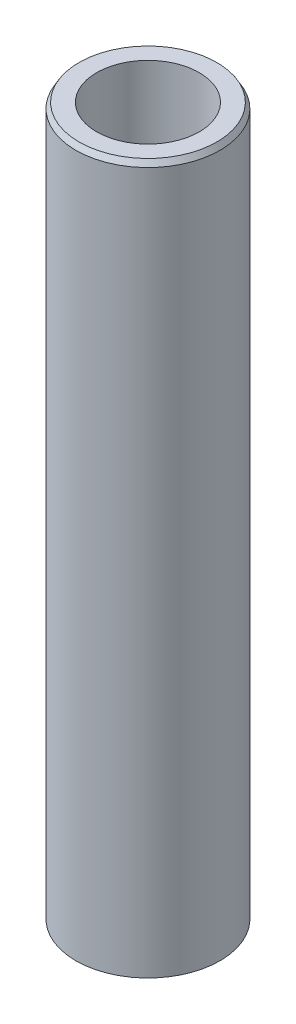
from build123d import *
from OCP.BRepFilletAPI import BRepFilletAPI_MakeChamfer

# Parameters (mm, degrees)
SKETCH1_R           = 32.5
BOSS_EXTRUDE1_DEPTH = 320.287423309
SKETCH2_R           = 23.128578784
CUT_EXTRUDE1_DEPTH  = 324.568437166
CHAMFER1_SIZE       = 2.523373402
CHAMFER1_SIZE2      = 1.456870313


with BuildPart() as part:
    # Sketch1 → Boss-Extrude1 (new body)
    with BuildSketch(Plane(origin=(0, 0, 0), x_dir=(1, 0, 0), z_dir=(0, 1, 0))):
        Circle(SKETCH1_R)
    extrude(amount=BOSS_EXTRUDE1_DEPTH)

    # Sketch2 → Cut-Extrude1 (cut, through all)
    with BuildSketch(Plane(origin=(0, 0, 0), x_dir=(1, 0, 0), z_dir=(0, 1, 0))):
        Circle(SKETCH2_R)
    extrude(amount=CUT_EXTRUDE1_DEPTH, mode=Mode.SUBTRACT)

    # Chamfer1: one chamfer whose edges measure the first distance from different faces: ONE call of the kernel's chamfer builder (chamfer() names one face for all edges)
    chamfer1_edges_1 = [part.edges().sort_by_distance(p)[0] for p in [
        (-32.5, 320.287423309, 0),
    ]]
    chamfer1_side_1 = [part.faces().sort_by_distance(p)[0] for p in [
        (-32.5, 160.143711655, 0),
    ]]
    chamfer1_edges_2 = [part.edges().sort_by_distance(p)[0] for p in [
        (-32.5, 0, 0),
    ]]
    chamfer1_side_2 = [part.faces().sort_by_distance(p)[0] for p in [
        (-31.580761184, 0, 0),
    ]]
    chamfer1 = BRepFilletAPI_MakeChamfer(part.part.solid().wrapped)
    for e in chamfer1_edges_1:
        chamfer1.Add(CHAMFER1_SIZE, CHAMFER1_SIZE2, e.wrapped, chamfer1_side_1[0].wrapped)  # the first distance lies on this face
    for e in chamfer1_edges_2:
        chamfer1.Add(CHAMFER1_SIZE, CHAMFER1_SIZE2, e.wrapped, chamfer1_side_2[0].wrapped)  # the first distance lies on this face
    add(Compound.cast(chamfer1.Shape()), mode=Mode.REPLACE)


solid = part.part
